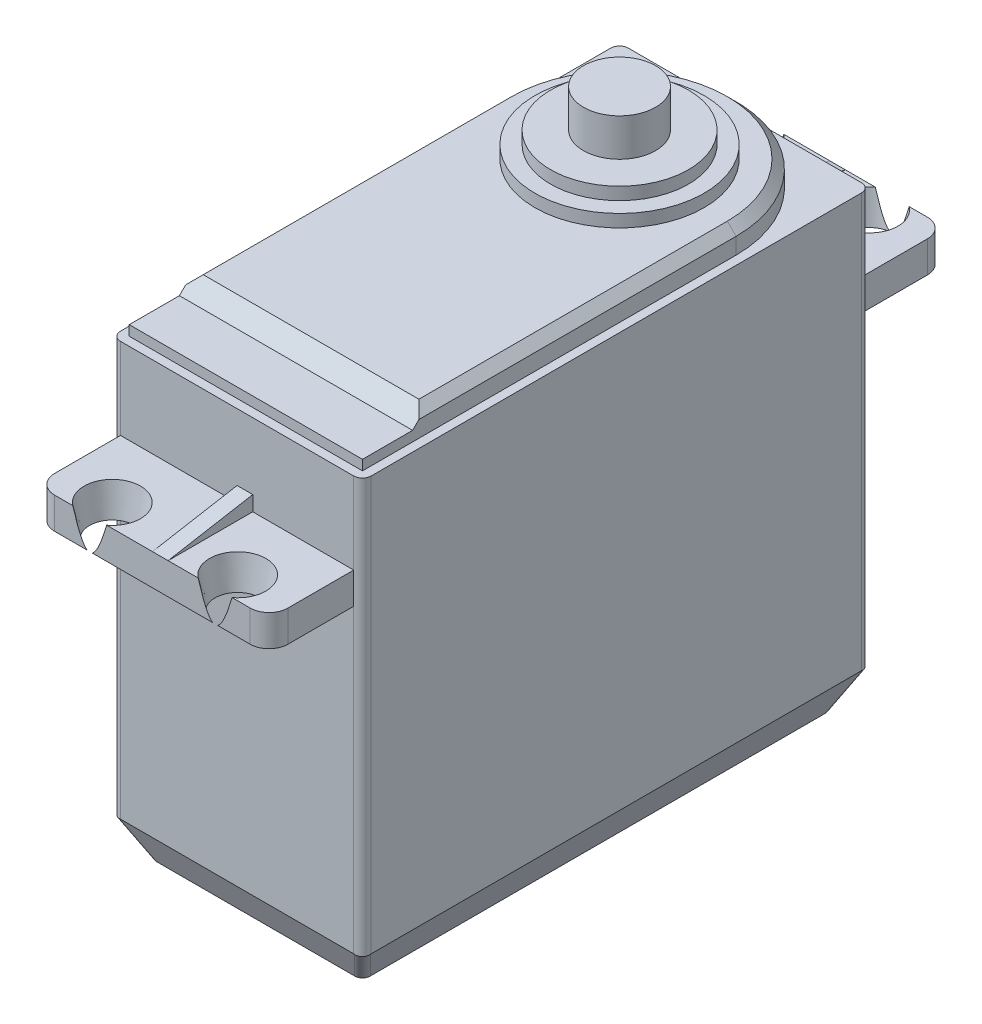
from build123d import *

# Parameters (mm, degrees)
SKETCH1_W               = 20
SKETCH1_H               = 40.5
BOSS_EXTRUDE1_DEPTH     = 18
BOSS_EXTRUDE2_DEPTH     = 2
BOSS_EXTRUDE3_DEPTH     = 2.5
FILLET1_R               = 1.5
BOSS_EXTRUDE4_DEPTH     = 1.25
DRAFT1_ANGLE            = 10
SKETCH7_W               = 7
SKETCH7_H               = 4
BOSS_EXTRUDE5_DEPTH     = 5
CUT_EXTRUDE1_DEPTH      = 39.13135193
CUT_EXTRUDE1_DEPTH_BACK = 39.13135193
CHAMFER1_SIZE           = 0.7
CHAMFER2_SIZE           = 1.5
CHAMFER2_SIZE2          = 3
FILLET2_R               = 0.7


with BuildPart() as part:
    # Sketch1 → Boss-Extrude1 (new, symmetric)
    with BuildSketch(Plane(origin=(0, 0, 0), x_dir=(1, 0, 0), z_dir=(0, 1, 0))):
        Rectangle(SKETCH1_W, SKETCH1_H)
    extrude(amount=BOSS_EXTRUDE1_DEPTH, both=True)

    # Sketch2 → Boss-Extrude2 (add)
    with BuildSketch(Plane(origin=(0, 18, 0), x_dir=(1, 0, 0), z_dir=(0, 1, 0))):
        with BuildLine():
            Line((-9.3, 10.25), (-9.3, -19.55))
            Line((-9.3, -19.55), (9.3, -19.55))
            Line((9.3, -19.55), (9.3, 10.25))
            ThreePointArc((9.3, 10.25), (0, 19.55), (-9.3, 10.25))
        make_face()
    extrude(amount=BOSS_EXTRUDE2_DEPTH)

    # Sketch4 → Revolve1 (revolve)
    with BuildSketch(Plane(origin=(0, 0, 0), x_dir=(0, 0, -1), z_dir=(1, 0, 0))):
        Polygon((10.25, 20), (10.25, 25), (13.125, 25), (13.125, 22), (15.75, 22), (15.75, 21), (17, 21), (17, 20), align=None)
    revolve(axis=Axis((0, 20, -10.25), (0, 1, 0)))

    # Sketch5 → Boss-Extrude3 (add)
    with BuildSketch(Plane(origin=(0, 9, 0), x_dir=(-1, 0, 0), z_dir=(0, -1, 0))):
        with BuildLine():
            Line((-9.3, 20.25), (9.3, 20.25))
            Line((9.3, 20.25), (9.3, 27))
            Line((9.3, 27), (6.35, 27))
            ThreePointArc((6.35, 27), (5, 22.95), (3.65, 27))
            Line((3.65, 27), (-3.65, 27))
            ThreePointArc((-3.65, 27), (-5, 22.95), (-6.35, 27))
            Line((-6.35, 27), (-9.3, 27))
            Line((-9.3, 27), (-9.3, 20.25))
        make_face()
        with BuildLine():
            Line((9.3, -20.25), (-9.3, -20.25))
            Line((-9.3, -20.25), (-9.3, -27))
            Line((-9.3, -27), (-6.35, -27))
            ThreePointArc((-6.35, -27), (-5, -22.95), (-3.65, -27))
            Line((-3.65, -27), (3.65, -27))
            ThreePointArc((3.65, -27), (5, -22.95), (6.35, -27))
            Line((6.35, -27), (9.3, -27))
            Line((9.3, -27), (9.3, -20.25))
        make_face()
    extrude(amount=-BOSS_EXTRUDE3_DEPTH)

    # Fillet1
    fillet1_edges = [part.edges().sort_by_distance(p)[0] for p in [
        (-9.3, 10.25, -27),
        (9.3, 10.25, -27),
        (9.3, 10.25, 27),
        (-9.3, 10.25, 27),
    ]]
    fillet(fillet1_edges, radius=FILLET1_R)

    # Sketch6 → Boss-Extrude4 (add)
    with BuildSketch(Plane(origin=(0, 0, 0), x_dir=(0, 0, -1), z_dir=(1, 0, 0))):
        Polygon((20.25, 11.5), (27, 11.5), (20.25, 12.69020712), align=None)
        Polygon((-20.25, 12.69020712), (-20.25, 11.5), (-27, 11.5), align=None)
    extrude(amount=BOSS_EXTRUDE4_DEPTH)

    # Draft1
    draft1_faces = [part.faces().sort_by_distance(p)[0] for p in [
        (5, 10.25, 22.95),
        (-5, 10.25, 22.95),
        (-5, 10.25, -22.95),
        (5, 10.25, -22.95),
    ]]
    draft(draft1_faces, Plane.ZX.offset(11.5), DRAFT1_ANGLE)

    # Sketch7 → Boss-Extrude5 (add)
    with BuildSketch(Plane(origin=(0, 0, -20.25), x_dir=(-1, 0, 0), z_dir=(0, 0, -1))):
        with Locations((0, -12.5)):
            Rectangle(SKETCH7_W, SKETCH7_H)
    extrude(amount=BOSS_EXTRUDE5_DEPTH)

    # Sketch8 → Cut-Extrude1 (cut, two sides: drawn at the far end of the back side and taken through both)
    with BuildSketch(Plane(origin=(0, 0, 0), x_dir=(0, 0, -1), z_dir=(1, 0, 0)).offset(-CUT_EXTRUDE1_DEPTH_BACK)):
        Polygon((-19.55, 18.8), (-15.55, 18.8), (-14.35, 20), (-19.55, 20), align=None)
    extrude(amount=CUT_EXTRUDE1_DEPTH + CUT_EXTRUDE1_DEPTH_BACK, mode=Mode.SUBTRACT)

    # Chamfer1
    chamfer1_edges = [part.edges().sort_by_distance(p)[0] for p in [
        (9.3, 20, 2.05),
        (0, 20, -19.55),
        (-9.3, 20, 2.05),
    ]]
    chamfer(chamfer1_edges, length=CHAMFER1_SIZE)

    # Chamfer2
    chamfer2_edges = [part.edges().sort_by_distance(p)[0] for p in [
        (0, -18, 20.25),
        (-10, -18, 0),
        (0, -18, -20.25),
        (10, -18, 0),
    ]]
    chamfer2_side = [part.faces().sort_by_distance(p)[0] for p in [
        (0, -18, 0),
    ]]
    chamfer(chamfer2_edges, length=CHAMFER2_SIZE, length2=CHAMFER2_SIZE2, reference=chamfer2_side[0])

    # Fillet2
    # the kernel refuses this fillet: 0.7 mm, written as the material it takes off along each edge
    with BuildSketch(Plane(origin=(7.916666667, -19.166666667, 18.166666667), x_dir=(-0.9128709291752769, 0.365148371670112, 0.1825741858350529), z_dir=(0.4082482904638631, 0.8164965809277261, 0.4082482904638631)), Plane(origin=(7.916666667, -19.166666667, -18.166666667), x_dir=(0.18257418583505539, 0.36514837167011077, 0.9128709291752769), z_dir=(0.4082482904638631, 0.8164965809277261, -0.4082482904638631))) as fillet2_piece_1:
        with BuildLine():
            CenterArc((FILLET2_R * 0.816496580928, -FILLET2_R), FILLET2_R, 90, 78.463040967)
            Line((-FILLET2_R * 0.163299316186, -FILLET2_R * 0.8), (0, 0))
            Line((0, 0), (FILLET2_R * 0.816496580928, 0))
        make_face()
    extrude(amount=6.531972647, mode=Mode.SUBTRACT)
    with BuildSketch(Plane(origin=(-7.916666667, -19.166666667, 18.166666667), x_dir=(0.9128709291752769, 0.3651483716701107, 0.18257418583505536), z_dir=(-0.4082482904638631, 0.8164965809277261, 0.4082482904638631)), Plane(origin=(-7.916666667, -19.166666667, -18.166666667), x_dir=(-0.18257418583505539, 0.36514837167011077, 0.9128709291752769), z_dir=(-0.4082482904638631, 0.8164965809277261, -0.4082482904638631))) as fillet2_piece_2:
        with BuildLine():
            CenterArc((FILLET2_R * 0.816496580928, FILLET2_R), FILLET2_R, 191.536959033, 78.463040967)
            Line((-FILLET2_R * 0.163299316186, FILLET2_R * 0.8), (0, 0))
            Line((0, 0), (FILLET2_R * 0.816496580928, 0))
        make_face()
    extrude(amount=6.531972647, mode=Mode.SUBTRACT)
    with BuildSketch(Plane(origin=(10, -16.75, 20.25), x_dir=(-1, 0, 0), z_dir=(0, 1, 0)), Plane(origin=(-10, 19.75, 20.25), x_dir=(1, 0, 0), z_dir=(0, -1, 0)), Plane(origin=(-10, 19.75, -20.25), x_dir=(0, 0, 1), z_dir=(0, -1, 0)), Plane(origin=(10, -16.75, -20.25), x_dir=(0, 0, 1), z_dir=(0, 1, 0))) as fillet2_piece_3:
        with BuildLine():
            CenterArc((FILLET2_R, -FILLET2_R), FILLET2_R, 90, 90)
            Line((0, -FILLET2_R), (0, 0))
            Line((0, 0), (FILLET2_R, 0))
        make_face()
    extrude(amount=36.5, mode=Mode.SUBTRACT)


solid = part.part
